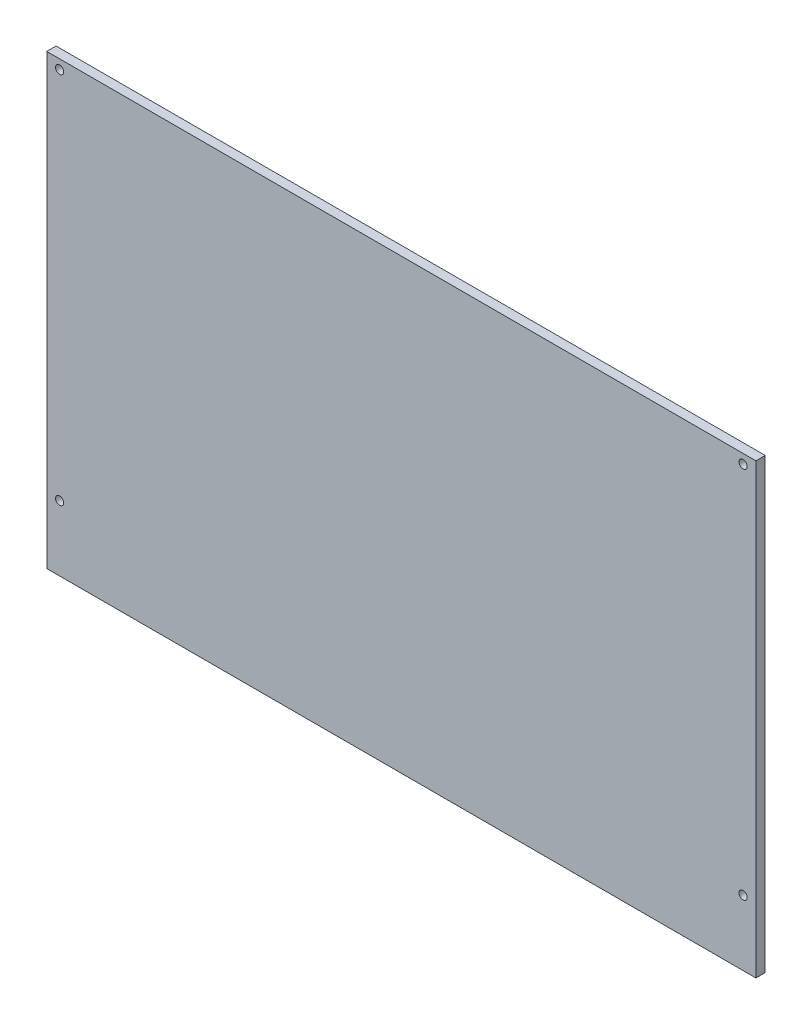
from build123d import *

# Parameters (mm, degrees)
SKETCH1_W           = 482.6
SKETCH1_H           = 304.8
BOSS_EXTRUDE1_DEPTH = 6.35
SKETCH2_R           = 2.7813
CUT_EXTRUDE1_DEPTH  = 286.467638271


with BuildPart() as part:
    # Sketch1 → Boss-Extrude1 (new body)
    with BuildSketch(Plane.XY):
        Rectangle(SKETCH1_W, SKETCH1_H)
    extrude(amount=BOSS_EXTRUDE1_DEPTH)

    # Sketch2 → Cut-Extrude1 (cut, through all)
    with BuildSketch(Plane.XY.offset(6.35)):
        with Locations((-232.5624, 146.05)):
            Circle(SKETCH2_R)
        with Locations((-232.5624, -107.95)):
            Circle(SKETCH2_R)
    cut_extrude1 = extrude(amount=-CUT_EXTRUDE1_DEPTH, mode=Mode.SUBTRACT)

    # Mirror1: Cut-Extrude1 across plane
    add(cut_extrude1.mirror(Plane(origin=(0, 0, 0), x_dir=(0, 0, 1), z_dir=(1, 0, 0))), mode=Mode.SUBTRACT)


solid = part.part
